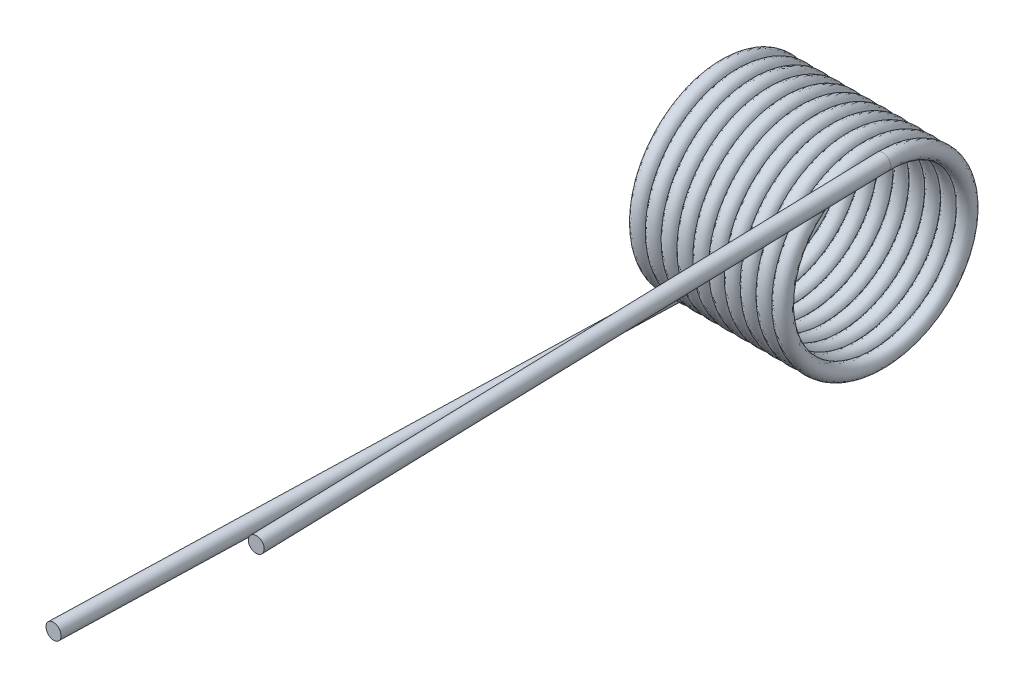
from build123d import *

# Parameters (mm, degrees)
SWEEP1_PITCH   = 1.2446
SKETCH4_R      = 0.6096
EXTRUDE1_DEPTH = 50.8
SKETCH5_R      = 0.6096
EXTRUDE2_DEPTH = 50.8


with BuildPart() as part:
    # Sweep1: the profile of Sketch3 screwed along a right-hand helix of 10.5 turns, 6 arcs to a turn; built about Z, then put on its axis
    sweep1_z = Axis((0, 0, 0), (0, 0, 1))
    sweep1_corners = [(6.961064744, -0.017370411, 0.609187811), (7.556335411, 0.00040373, -0.014158989), (6.932735256, 0.017370411, -0.609187811), (6.337464589, -0.00040373, 0.014158989)]
    with BuildLine(mode=Mode.PRIVATE) as sweep1_profile:
        ThreePointArc((6.961064744, -0.017370411, 0.609187811), (7.387851898, -0.011997255, 0.420748915), (7.556335411, 0.00040373, -0.014158989))
        ThreePointArc((7.556335411, 0.00040373, -0.014158989), (7.367819925, 0.012568215, -0.44077275), (6.932735256, 0.017370411, -0.609187811))
        ThreePointArc((6.932735256, 0.017370411, -0.609187811), (6.505948102, 0.011997255, -0.420748915), (6.337464589, -0.00040373, 0.014158989))
        ThreePointArc((6.337464589, -0.00040373, 0.014158989), (6.525980075, -0.012568215, 0.44077275), (6.961064744, -0.017370411, 0.609187811))
    sweep1_cap = Face(sweep1_profile.wire())
    sweep1_arcs = [((6.961064744, -0.017370411, 0.609187811), (7.570500155, -0.016966681, 0.595028821), (7.556335411, 0.00040373, -0.014158989), (1, 0.7071067811865476, 1)), ((7.556335411, 0.00040373, -0.014158989), (7.542170667, 0.017774141, -0.6233468), (6.932735256, 0.017370411, -0.609187811), (1, 0.7071067811865476, 1)), ((6.932735256, 0.017370411, -0.609187811), (6.323299845, 0.016966681, -0.595028821), (6.337464589, -0.00040373, 0.014158989), (1, 0.7071067811865476, 1)), ((6.337464589, -0.00040373, 0.014158989), (6.351629333, -0.017774141, 0.6233468), (6.961064744, -0.017370411, 0.609187811), (1, 0.7071067811865476, 1))]  # start, shoulder, end, weights
    sweep1_turn_angles = [0, 30, 60, 90, 120, 150, 180, 210, 240, 270, 300, 330, 360]
    sweep1_turn_weights = [1, 0.8660254037844387, 1, 0.8660254037844387, 1, 0.8660254037844387, 1, 0.8660254037844387, 1, 0.8660254037844387, 1, 0.8660254037844387, 1]
    sweep1_turn_sides = [Face.make_bezier_surface([[Vector(p[j][0], p[j][1], 0).rotate(sweep1_z, sweep1_turn_angles[2 * i + k]) / sweep1_turn_weights[2 * i + k] + Vector(0, 0, p[j][2] + SWEEP1_PITCH * sweep1_turn_angles[2 * i + k] / 360) for k in range(3)] for j in range(3)], [[p[3][j] * sweep1_turn_weights[2 * i + k] for k in range(3)] for j in range(3)]) for p in sweep1_arcs for i in range(6)]
    sweep1_last_angles = [3600, 3630, 3660, 3690, 3720, 3750, 3780]
    sweep1_last_weights = [1, 0.8660254037844387, 1, 0.8660254037844387, 1, 0.8660254037844287, 1]
    sweep1_last_sides = [Face.make_bezier_surface([[Vector(p[j][0], p[j][1], 0).rotate(sweep1_z, sweep1_last_angles[2 * i + k]) / sweep1_last_weights[2 * i + k] + Vector(0, 0, p[j][2] + SWEEP1_PITCH * sweep1_last_angles[2 * i + k] / 360) for k in range(3)] for j in range(3)], [[p[3][j] * sweep1_last_weights[2 * i + k] for k in range(3)] for j in range(3)]) for p in sweep1_arcs for i in range(3)]
    sweep1 = Plane(origin=(0, 0, 0), x_dir=(0, -1, 0), z_dir=(1, 0, 0)) * Solid(Shell([*[p.moved(Location((0, 0, SWEEP1_PITCH * i))) for i in range(10) for p in sweep1_turn_sides], *sweep1_last_sides, sweep1_cap, sweep1_cap.rotate(sweep1_z, 3780).moved(Location((0, 0, SWEEP1_PITCH * 3780 / 360)))]))
    add(sweep1)

    # Sketch4 → Extrude1 (add)
    with BuildSketch(Plane(origin=(0, 0, 0), x_dir=(-0.9993238366479685, 0.023236129092748532, -0.02849476815082974), z_dir=(-0.02850246368195815, -1.0555683931101623e-14, 0.9995937222512249))):
        with Locations(Location((-0.161419065, 6.94502437, 0), (0, 0, 181.33145196))):
            Circle(SKETCH4_R)
    extrude(amount=EXTRUDE1_DEPTH)

    # Sketch5 → Extrude2 (add)
    with BuildSketch(Plane(origin=(0.010616562, 0, 0.372327416), x_dir=(0.9984320723413997, -0.04819640630425527, -0.028469340340322943), z_dir=(0.028502463681958145, -1.5367568328983339e-13, 0.9995937222512248))):
        with Locations(Location((12.712994236, 7.568416059, 0), (0, 0, 182.762520881))):
            Circle(SKETCH5_R)
    extrude(amount=EXTRUDE2_DEPTH)


solid = part.part
